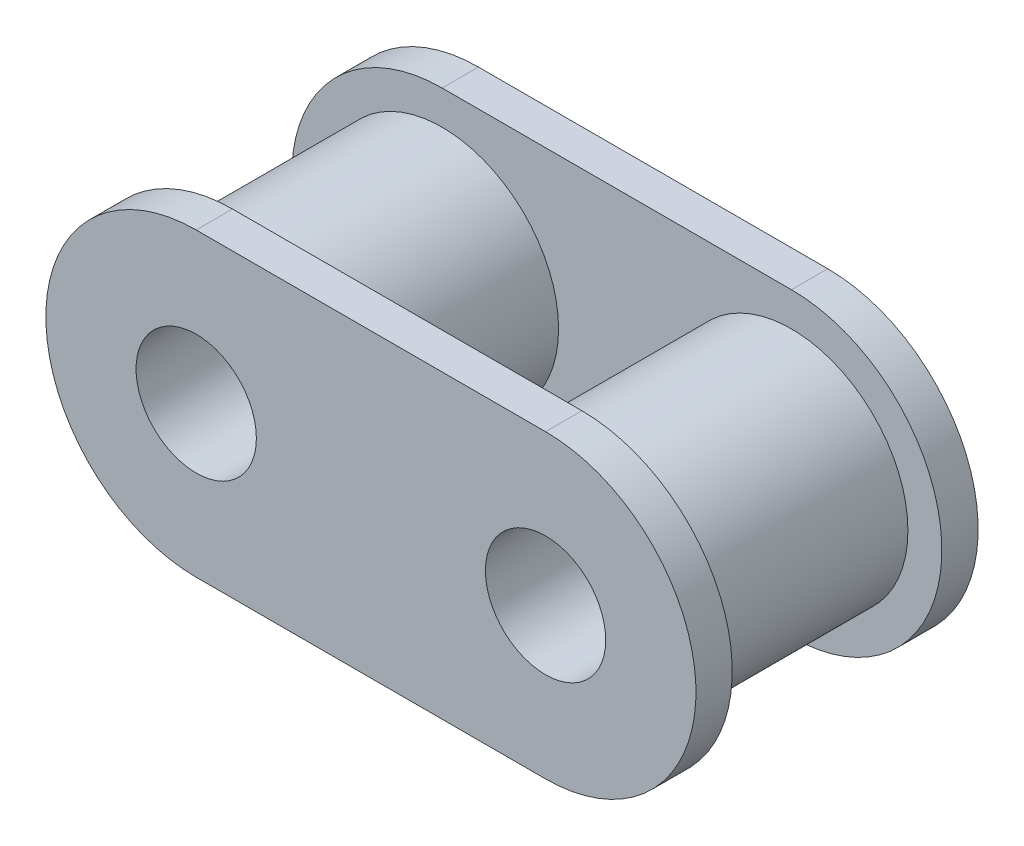
from build123d import *

# Parameters (mm, degrees)
SKETCH1_R           = 1.64
BOSS_EXTRUDE1_DEPTH = 0.99
SKETCH2_R           = 3.175
SKETCH2_R_2         = 1.64
BOSS_EXTRUDE2_DEPTH = 6.705


with BuildPart() as part:
    # Sketch1 → Boss-Extrude1 (new body)
    with BuildSketch(Plane.XY):
        with BuildLine():
            Line((0, 4.1), (9.525, 4.1))
            ThreePointArc((9.525, 4.1), (13.625, 0), (9.525, -4.1))
            Line((9.525, -4.1), (0, -4.1))
            ThreePointArc((0, -4.1), (-4.1, 0), (0, 4.1))
        make_face()
        Circle(SKETCH1_R, mode=Mode.SUBTRACT)
        with Locations((9.525, 0)):
            Circle(SKETCH1_R, mode=Mode.SUBTRACT)
    extrude(amount=BOSS_EXTRUDE1_DEPTH)

    # Sketch2 → Boss-Extrude2 (add)
    # profile 1 of 2: a face of its own
    with BuildSketch(Plane.XY.offset(0.99)):
        Circle(SKETCH2_R)
        Circle(SKETCH2_R_2, mode=Mode.SUBTRACT)
    # profile 2 of 2: a face of its own
    with BuildSketch(Plane.XY.offset(0.99)):
        with Locations((9.525, 0)):
            Circle(SKETCH2_R)
        with Locations((9.525, 0)):
            Circle(SKETCH2_R_2, mode=Mode.SUBTRACT)
    extrude(amount=BOSS_EXTRUDE2_DEPTH)

    # Mirror1: part across plane


with BuildPart() as part_1:
    add(part.part)
    add(part.part.mirror(Plane(origin=(0, 0, 3.8475), x_dir=(1, 0, 0), z_dir=(0, 0, -1))))


solid = part_1.part
